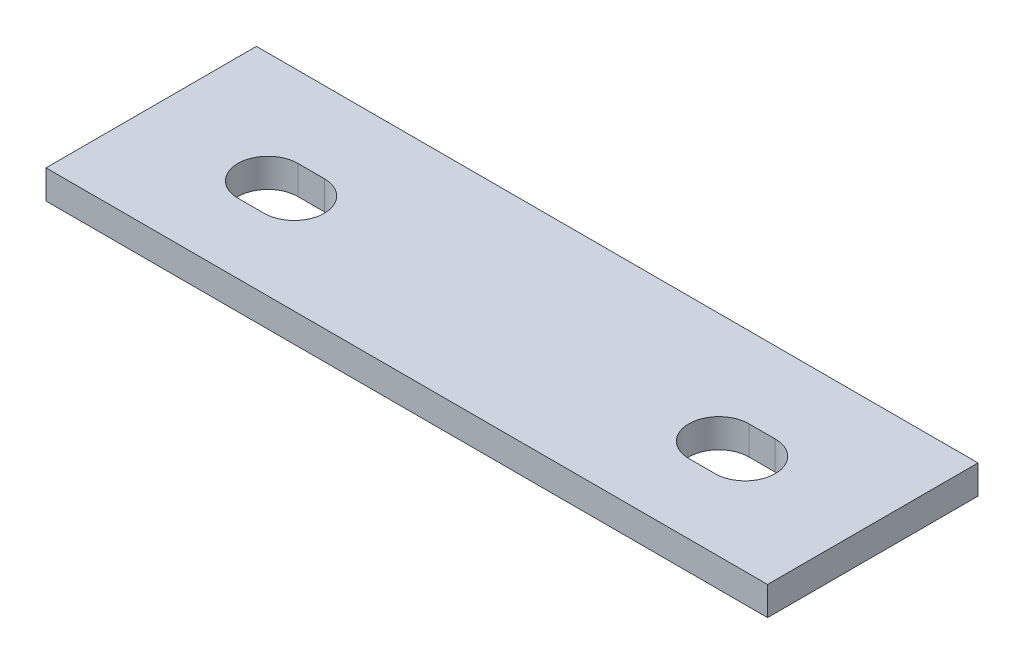
from build123d import *

# Parameters (mm, degrees)
SKETCH2_W               = 152.4
SKETCH2_H               = 44.45
BASE_FLANGE1_DEPTH      = 6.07314
CUT_EXTRUDE1_DEPTH      = 159.86612455
CUT_EXTRUDE1_DEPTH_BACK = 159.86612455


# Sheet-metal steps are written as plain solids
with BuildPart() as part:
    # Sketch2 → Base-Flange1 (new body)
    with BuildSketch(Plane(origin=(0, 0, 0), x_dir=(1, 0, 0), z_dir=(0, 1, 0))):
        with Locations((76.2, 22.225)):
            Rectangle(SKETCH2_W, SKETCH2_H)
    extrude(amount=-BASE_FLANGE1_DEPTH)

    # Sketch7 → Cut-Extrude1 (cut, two sides: drawn at the far end of the back side and taken through both)
    with BuildSketch(Plane.XZ.offset(6.07314).offset(-CUT_EXTRUDE1_DEPTH_BACK)):
        with BuildLine():
            Line((121.046875, -27.42184), (126.603125, -27.42184))
            ThreePointArc((126.603125, -27.42184), (132.953125, -21.07184), (126.603125, -14.72184))
            Line((126.603125, -14.72184), (121.046875, -14.72184))
            ThreePointArc((121.046875, -14.72184), (114.696875, -21.07184), (121.046875, -27.42184))
        make_face()
        with BuildLine():
            Line((31.353125, -14.72184), (25.796875, -14.72184))
            ThreePointArc((25.796875, -14.72184), (19.446875, -21.07184), (25.796875, -27.42184))
            Line((25.796875, -27.42184), (31.353125, -27.42184))
            ThreePointArc((31.353125, -27.42184), (37.703125, -21.07184), (31.353125, -14.72184))
        make_face()
    extrude(amount=CUT_EXTRUDE1_DEPTH + CUT_EXTRUDE1_DEPTH_BACK, mode=Mode.SUBTRACT)


solid = part.part
